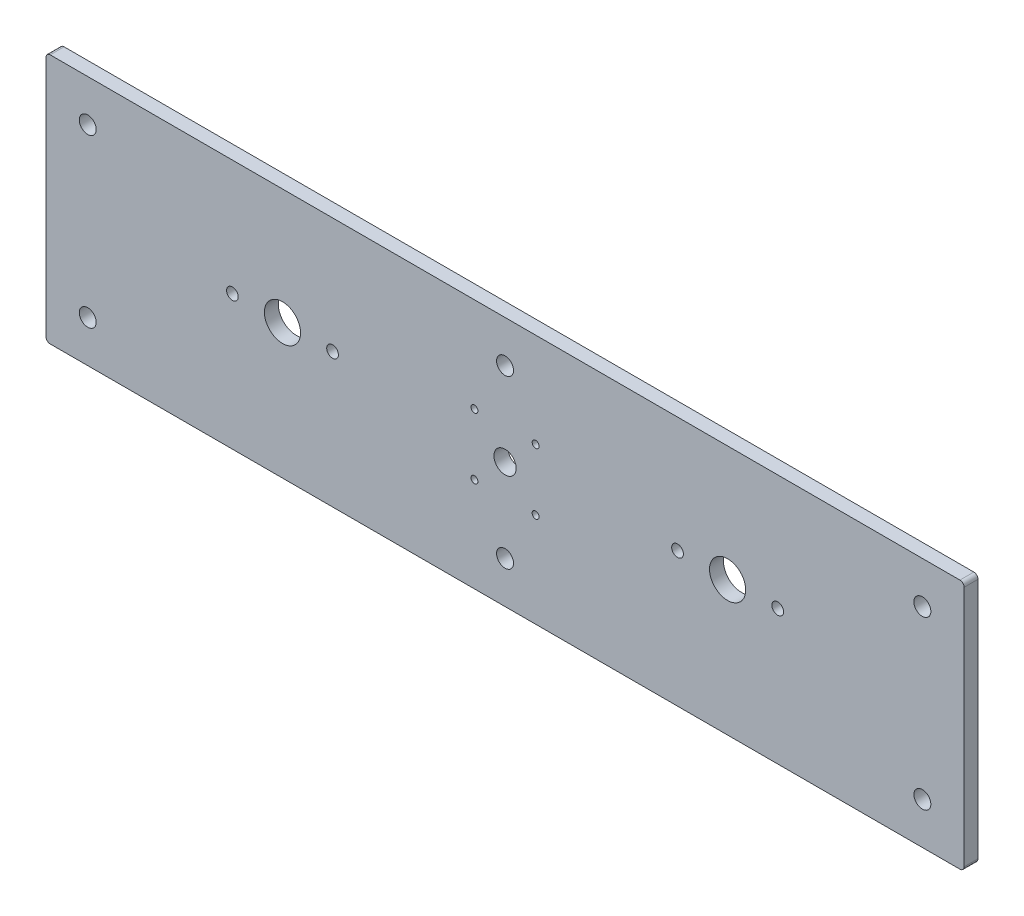
from build123d import *

# Parameters (mm, degrees)
SKETCH1_W           = 330
SKETCH1_H           = 90
BOSS_EXTRUDE1_DEPTH = 2.5
SKETCH2_R           = 3.05
CUT_EXTRUDE1_DEPTH  = 172.099386323
SKETCH3_R           = 6.5
SKETCH3_R_2         = 2.1
CUT_EXTRUDE2_DEPTH  = 172.099386323
SKETCH4_R           = 1.25
SKETCH4_R_2         = 4
CUT_EXTRUDE3_DEPTH  = 172.099386323
FILLET1_R           = 1.5


with BuildPart() as part:
    # Sketch1 → Boss-Extrude1 (new, symmetric)
    with BuildSketch(Plane.XY):
        Rectangle(SKETCH1_W, SKETCH1_H)
    extrude(amount=BOSS_EXTRUDE1_DEPTH, both=True)

    # Sketch2 → Cut-Extrude1 (cut, through all)
    with BuildSketch(Plane.XY.offset(2.5)):
        with Locations((150, 30)):
            Circle(SKETCH2_R)
        with Locations((150, -30)):
            Circle(SKETCH2_R)
        with Locations((0, 30)):
            Circle(SKETCH2_R)
        with Locations((0, -30)):
            Circle(SKETCH2_R)
        with Locations((-150, -30)):
            Circle(SKETCH2_R)
        with Locations((-150, 30)):
            Circle(SKETCH2_R)
    extrude(amount=-CUT_EXTRUDE1_DEPTH, mode=Mode.SUBTRACT)

    # Sketch3 → Cut-Extrude2 (cut, through all)
    with BuildSketch(Plane.XY.offset(2.5)):
        with Locations((-80, 3.4)):
            Circle(SKETCH3_R)
        with Locations((-62, 3.4)):
            Circle(SKETCH3_R_2)
        with Locations((-98, 3.4)):
            Circle(SKETCH3_R_2)
    cut_extrude2 = extrude(amount=-CUT_EXTRUDE2_DEPTH, mode=Mode.SUBTRACT)

    # Mirror1: Cut-Extrude2 across plane
    add(cut_extrude2.mirror(Plane(origin=(0, 0, 0), x_dir=(0, 0, 1), z_dir=(1, 0, 0))), mode=Mode.SUBTRACT)

    # Sketch4 → Cut-Extrude3 (cut, through all)
    with BuildSketch(Plane.XY.offset(2.5)):
        with Locations((11, 11)):
            Circle(SKETCH4_R)
        with Locations((11, -11)):
            Circle(SKETCH4_R)
        with Locations((-11, -11)):
            Circle(SKETCH4_R)
        with Locations((-11, 11)):
            Circle(SKETCH4_R)
        Circle(SKETCH4_R_2)
    extrude(amount=-CUT_EXTRUDE3_DEPTH, mode=Mode.SUBTRACT)

    # Fillet1
    fillet1_edges = [part.edges().sort_by_distance(p)[0] for p in [
        (-165, -45, 0),
        (-165, 45, 0),
        (165, -45, 0),
        (165, 45, 0),
    ]]
    fillet(fillet1_edges, radius=FILLET1_R)


solid = part.part
